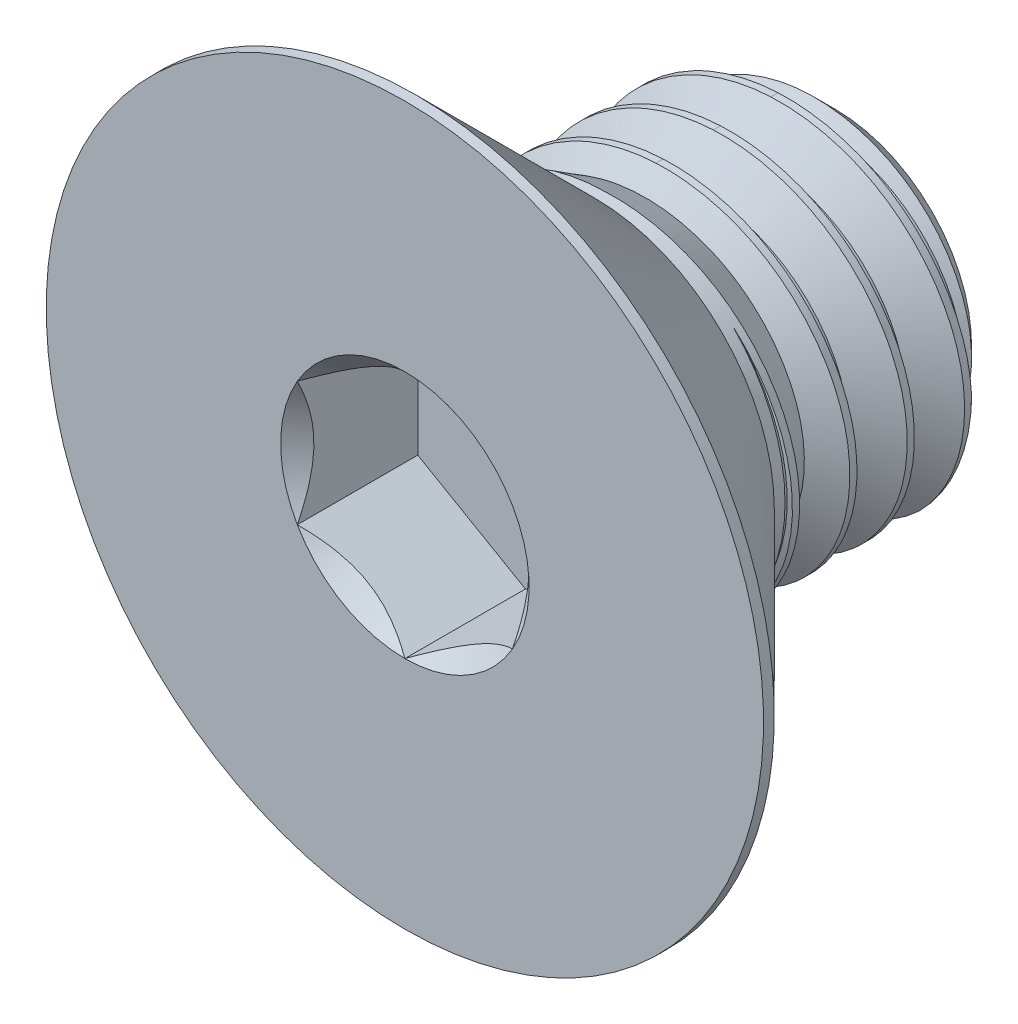
from build123d import *

# Parameters (mm, degrees)
CUT_EXTRUDE2_DEPTH  = 1.68
SKETCH6_R           = 1.732050808
CUT_EXTRUDE3_DEPTH  = 1.68
CUT_EXTRUDE3_TAPER  = 45
CUT_SWEEP1_PITCH    = 0.8
CUT_SWEEP1_TO       = 3.2
SKETCH9_R           = 2.5
BOSS_EXTRUDE1_DEPTH = 3.2
BOSS_EXTRUDE1_DRAFT = -30.9


with BuildPart() as part:
    # Sketch7 → Revolve2 (revolve)
    with BuildSketch(Plane(origin=(0, 0, 0), x_dir=(0, 0, -1), z_dir=(1, 0, 0))):
        Polygon((-2.8, 0), (-2.8, 5), (-2.65, 5), (-0.15, 2.5), (2.6, 2.5), (3.2, 1.9), (3.2, 0), align=None)
    revolve(axis=Axis((0, 0, -3.2), (0, 0, 1)))

    # Sketch5 → Cut-Extrude2 (cut)
    with BuildSketch(Plane.XY.offset(2.8)):
        Polygon((1.5, -0.866025404), (1.5, 0.866025404), (0, 1.732050808), (-1.5, 0.866025404), (-1.5, -0.866025404), (0, -1.732050808), align=None)
    extrude(amount=-CUT_EXTRUDE2_DEPTH, mode=Mode.SUBTRACT)

    # Sketch6 → Cut-Extrude3 (cut)
    with BuildSketch(Plane.XY.offset(2.8)):
        Circle(SKETCH6_R)
    extrude(amount=-CUT_EXTRUDE3_DEPTH, taper=CUT_EXTRUDE3_TAPER, mode=Mode.SUBTRACT)


with BuildPart() as body_2:
    # Split1: the piece on the far side of the plane
    add(part.part)
    split(bisect_by=Plane.XY, keep=Keep.BOTTOM)

    # Cut-Sweep1: arcs per turn and ends read off the stored shape
    # Cut-Sweep1: the profile of Sketch8 screwed along a right-hand helix through 5 turns, 8 arcs to a turn; built about Z, then put on its axis
    cut_sweep1_z = Axis((0, 0, 0), (0, 0, 1))
    cut_sweep1_corners = [(2.54330127, 0, 0.025), (2.54330127, 0, -0.725), (1.980384758, 0, -0.4), (1.980384758, 0, -0.3)]
    with BuildLine(mode=Mode.PRIVATE) as cut_sweep1_profile:
        Line(cut_sweep1_corners[0], cut_sweep1_corners[1])
        Line(cut_sweep1_corners[1], cut_sweep1_corners[2])
        Line(cut_sweep1_corners[2], cut_sweep1_corners[3])
        Line(cut_sweep1_corners[3], cut_sweep1_corners[0])
    cut_sweep1_cap = Face(cut_sweep1_profile.wire())
    cut_sweep1_turn_angles = [0, 22.5, 45, 67.5, 90, 112.5, 135, 157.5, 180, 202.5, 225, 247.5, 270, 292.5, 315, 337.5, 360]
    cut_sweep1_turn_weights = [1, 0.9238795325112867, 1, 0.9238795325112867, 1, 0.9238795325112867, 1, 0.9238795325112867, 1, 0.9238795325112867, 1, 0.9238795325112867, 1, 0.9238795325112867, 1, 0.9238795325112867, 1]
    cut_sweep1_turn_rails = [Edge.make_bspline([Vector(p[0], p[1], 0).rotate(cut_sweep1_z, cut_sweep1_turn_angles[k]) / cut_sweep1_turn_weights[k] + Vector(0, 0, p[2] + CUT_SWEEP1_PITCH * cut_sweep1_turn_angles[k] / 360) for k in range(17)], [0, 0, 0, 1, 1, 2, 2, 3, 3, 4, 4, 5, 5, 6, 6, 7, 7, 8, 8, 8], 2, cut_sweep1_turn_weights) for p in cut_sweep1_corners]
    cut_sweep1_turn_sides = [Face.make_surface_from_curves(cut_sweep1_turn_rails[p[0]], cut_sweep1_turn_rails[p[1]]) for p in [(0, 1), (1, 2), (2, 3), (3, 0)]]
    cut_sweep1 = Plane(origin=(0, 0, -3.2), x_dir=(0, 1, 0), z_dir=(0, 0, 1)) * split(Solid(Shell([*[p.moved(Location((0, 0, CUT_SWEEP1_PITCH * i))) for i in range(5) for p in cut_sweep1_turn_sides], cut_sweep1_cap, cut_sweep1_cap.rotate(cut_sweep1_z, 1800).moved(Location((0, 0, CUT_SWEEP1_PITCH * 1800 / 360)))])), bisect_by=Plane.XY.offset(CUT_SWEEP1_TO), keep=Keep.BOTTOM, mode=Mode.PRIVATE)
    add(cut_sweep1, mode=Mode.SUBTRACT)


with BuildPart() as part_1:
    add(part.part)

    # Split1
    split(bisect_by=Plane.XY, keep=Keep.TOP)


with BuildPart() as boss_extrude1_tool:
    # Sketch9 → Boss-Extrude1 (with draft: the straight prism first)
    with BuildSketch(Plane.XY):
        with Locations(Location((0, 0, 0), (0, 0, 90))):
            Circle(SKETCH9_R)
    extrude(amount=-BOSS_EXTRUDE1_DEPTH)
    # Boss-Extrude1: the draft: its side faces are tilted about the plane it starts from
    boss_extrude1_sides = [boss_extrude1_tool.faces().sort_by_distance(p)[0] for p in [
        (0, -2.5, -1.6),
    ]]
    draft(boss_extrude1_sides, Plane.XY, BOSS_EXTRUDE1_DRAFT)


with BuildPart() as part_2:
    add(part_1.part)

    # Boss-Extrude1: add boss_extrude1_tool
    add(boss_extrude1_tool.part)

    add(body_2.part)  # Boss-Extrude1 merges body 2


solid = part_2.part
